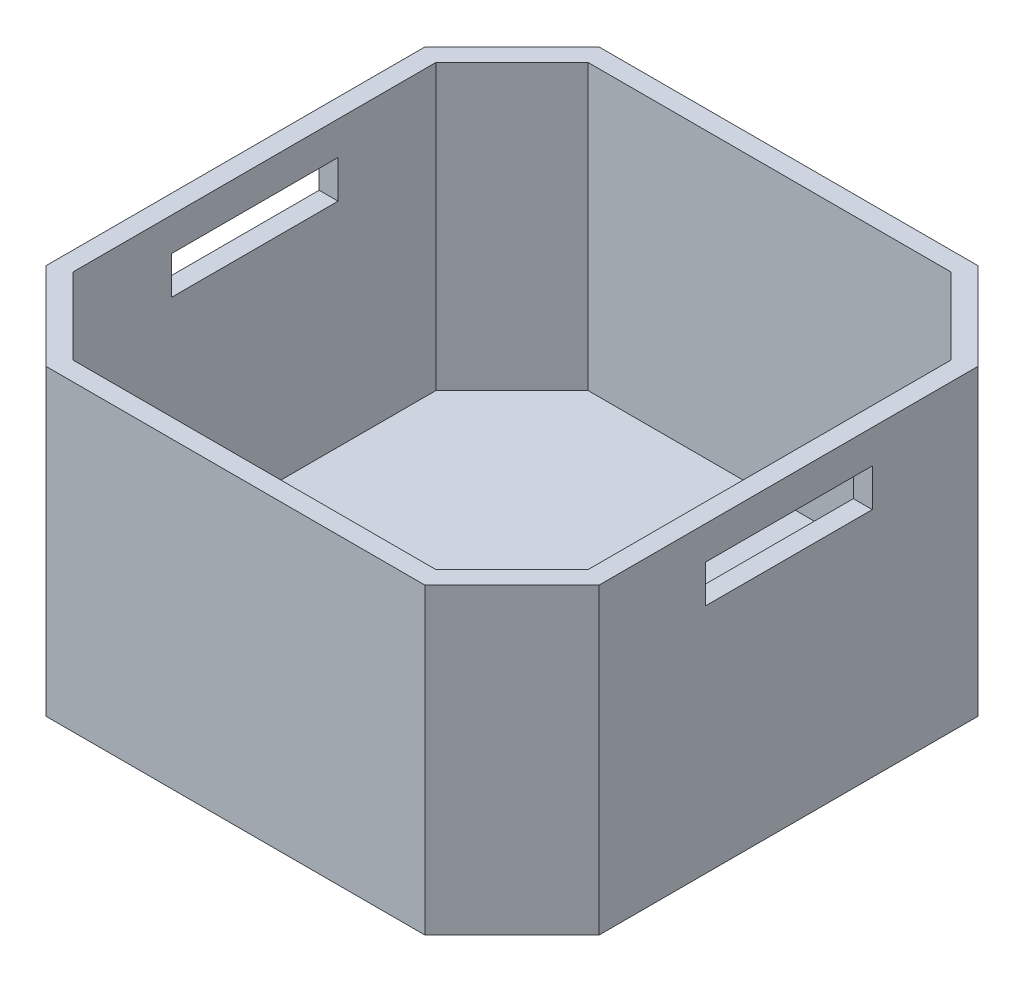
from build123d import *

# Parameters (mm, degrees)
SALIENTE_EXTRUIR1_DEPTH = 40
VACIADO1_T              = -2.5
CROQUIS5_W              = 22
CROQUIS5_H              = 5
CORTAR_EXTRUIR1_DEPTH   = 91.891418737


with BuildPart() as part:
    # Croquis3 → Saliente-Extruir1 (new body)
    with BuildSketch(Plane(origin=(0, 0, 0), x_dir=(1, 0, 0), z_dir=(0, 1, 0))):
        Polygon((-36.5, -25), (-25, -36.5), (25, -36.5), (36.5, -25), (36.5, 25), (25, 36.5), (-25, 36.5), (-36.5, 25), align=None)
    extrude(amount=SALIENTE_EXTRUIR1_DEPTH)

    # Vaciado1
    vaciado1_openings = [part.faces().sort_by_distance(p)[0] for p in [
        (0, 40, 0),
    ]]
    offset(amount=VACIADO1_T, openings=vaciado1_openings, kind=Kind.INTERSECTION)

    # Croquis5 → Cortar-Extruir1 (cut, through all)
    with BuildSketch(Plane.ZY.offset(36.5)):
        with Locations((-0.05, 33.1)):
            Rectangle(CROQUIS5_W, CROQUIS5_H)
    extrude(amount=-CORTAR_EXTRUIR1_DEPTH, mode=Mode.SUBTRACT)


solid = part.part
